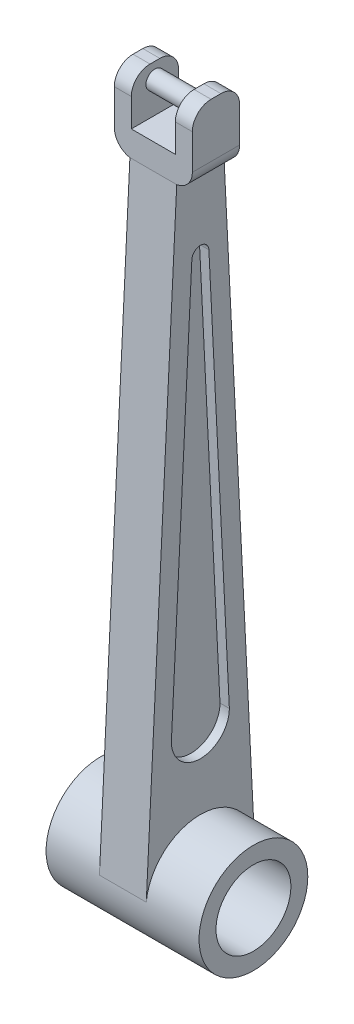
from build123d import *
from build123d.topology import SkipClean

# Parameters (mm, degrees)
Y_KSEKLIK_EKSTR_ZYON2_DEPTH      = 3.75
Y_KSEKLIK_EKSTR_ZYON3_DEPTH      = 2.25
IZIM4_R                          = 6
KES_EKSTR_ZYON1_DEPTH            = 15.5
Y_KSEKLIK_EKSTR_ZYON5_DEPTH      = 8.5
Y_KSEKLIK_EKSTR_ZYON5_DEPTH_BACK = 16
IZIM5_R                          = 8.707330246
IZIM5_R_2                        = 6
IZIM1_6_W                        = 7.569576012
IZIM1_6_H                        = 4.08664072
Y_KSEKLIK_EKSTR_ZYON6_DEPTH      = 6.25
IZIM6_W                          = 2.724991533
IZIM6_H                          = 7.569576012
Y_KSEKLIK_EKSTR_ZYON7_DEPTH      = 7.5
IZIM7_R                          = 1.441213073
Y_KSEKLIK_EKSTR_ZYON8_DEPTH      = 8.5
RADYUS1_R                        = 3


with BuildPart() as part:
    # Çizim1 → Yükseklik-Ekstrüzyon2 (new, symmetric)
    with BuildSketch(Plane(origin=(0, 0, 0), x_dir=(0, 0, -1), z_dir=(1, 0, 0))):
        with BuildLine():
            Line((3.784788006, 102.00780299), (-3.784788006, 102.00780299))
            Line((-3.784788006, 102.00780299), (-8.707330246, 4.05112335))
            ThreePointArc((-8.707330246, 4.05112335), (0, -4.656206896), (8.707330246, 4.05112335))
            Line((8.707330246, 4.05112335), (3.784788006, 102.00780299))
        make_face()
        with BuildLine():
            Line((-4.643687916, 25.141862002), (-1.364548141, 90.395470555))
            ThreePointArc((-1.364548141, 90.395470555), (0, 91.693168951), (1.364548141, 90.395470555))
            Line((1.364548141, 90.395470555), (4.643687916, 25.141862002))
            ThreePointArc((4.643687916, 25.141862002), (0, 20.498174086), (-4.643687916, 25.141862002))
        make_face(mode=Mode.SUBTRACT)
    extrude(amount=Y_KSEKLIK_EKSTR_ZYON2_DEPTH, both=True)

    # Çizim1<5> → Yükseklik-Ekstrüzyon3 (add, symmetric)
    with BuildSketch(Plane(origin=(0, 0, 0), x_dir=(0, 0, -1), z_dir=(1, 0, 0))):
        with BuildLine():
            Line((-1.364548141, 90.395470555), (-4.643687916, 25.141862002))
            ThreePointArc((-4.643687916, 25.141862002), (0, 20.498174086), (4.643687916, 25.141862002))
            Line((4.643687916, 25.141862002), (1.364548141, 90.395470555))
            ThreePointArc((1.364548141, 90.395470555), (0, 91.693168951), (-1.364548141, 90.395470555))
        make_face()
    extrude(amount=Y_KSEKLIK_EKSTR_ZYON3_DEPTH, both=True)

    # Çizim4 → Kes-Ekstrüzyon1 (cut)
    with BuildSketch(Plane(origin=(3.75, 0, 0), x_dir=(0, 0, -1), z_dir=(1, 0, 0))):
        with Locations((0, 4.05112335)):
            Circle(IZIM4_R)
    extrude(amount=-KES_EKSTR_ZYON1_DEPTH, mode=Mode.SUBTRACT)

    # Çizim5 → Yükseklik-Ekstrüzyon5 (add, two sides: drawn at the far end of the back side and taken through both)
    with SkipClean():  # the faces are left unmerged after this step: merging them gives an invalid solid
        with BuildSketch(Plane(origin=(3.75, 0, 0), x_dir=(0, 0, -1), z_dir=(1, 0, 0)).offset(-Y_KSEKLIK_EKSTR_ZYON5_DEPTH_BACK)):
            with Locations((0, 4.05112335)):
                Circle(IZIM5_R)
            with Locations((0, 4.05112335)):
                Circle(IZIM5_R_2, mode=Mode.SUBTRACT)
        extrude(amount=Y_KSEKLIK_EKSTR_ZYON5_DEPTH + Y_KSEKLIK_EKSTR_ZYON5_DEPTH_BACK)

    # Çizim1<6> → Yükseklik-Ekstrüzyon6 (add, symmetric)
    with BuildSketch(Plane(origin=(0, 0, 0), x_dir=(0, 0, -1), z_dir=(1, 0, 0))):
        with Locations((0, 104.05112335)):
            Rectangle(IZIM1_6_W, IZIM1_6_H)
    extrude(amount=Y_KSEKLIK_EKSTR_ZYON6_DEPTH, both=True)

    # Çizim6 → Yükseklik-Ekstrüzyon7 (add)
    with BuildSketch(Plane(origin=(0, 106.09444371, 0), x_dir=(1, 0, 0), z_dir=(0, 1, 0))):
        with Locations((-4.887504233, 0)):
            Rectangle(IZIM6_W, IZIM6_H)
        with Locations((4.887504233, 0)):
            Rectangle(IZIM6_W, IZIM6_H)
    extrude(amount=Y_KSEKLIK_EKSTR_ZYON7_DEPTH)

    # Çizim7 → Yükseklik-Ekstrüzyon8 (add)
    with BuildSketch(Plane(origin=(-3.525008467, 0, 0), x_dir=(0, 0, -1), z_dir=(1, 0, 0))):
        with Locations(Location((0, 111.076861872, 0), (0, 0, 180))):
            Circle(IZIM7_R)
    extrude(amount=Y_KSEKLIK_EKSTR_ZYON8_DEPTH)

    # Radyus1
    # the kernel refuses this fillet: 3 mm, written as the material it takes off along each edge
    with BuildSketch(Plane(origin=(6.25, 102.00780299, -11.179887735), x_dir=(0, 1, 0), z_dir=(0, 0, 1))) as radyus1_piece_1:
        with BuildLine():
            CenterArc((2.958039892, 3), RADYUS1_R, 189.594068227, 80.405931773)
            Line((0, 2.5), (-0.059160798, 2.49))
            ThreePointArc((-0.059160798, 2.49), (-0.06, 1.25), (-0.06, 0))
            Line((-0.06, 0), (0, -0.06))
            Line((0, -0.06), (2.958039892, -0.06))
            Line((2.958039892, -0.06), (2.958039892, 0))
        make_face()
    extrude(amount=22.359775471, mode=Mode.SUBTRACT)
    with BuildSketch(Plane(origin=(-6.25, 102.00780299, -11.179887735), x_dir=(1, 0, 0), z_dir=(0, 0, 1))) as radyus1_piece_2:
        with BuildLine():
            CenterArc((3, 2.958039892), RADYUS1_R, 180, 80.405931773)
            Line((0, 2.958039892), (-0.06, 2.958039892))
            Line((-0.06, 2.958039892), (-0.06, 0))
            Line((-0.06, 0), (0, -0.06))
            ThreePointArc((0, -0.06), (1.25, -0.06), (2.49, -0.059160798))
            Line((2.49, -0.059160798), (2.5, 0))
        make_face()
    extrude(amount=22.359775471, mode=Mode.SUBTRACT)
    with BuildSketch(Plane(origin=(13.75, 113.59444371, 3.784788006), x_dir=(0, -1, 0), z_dir=(-1, 0, 0)), Plane(origin=(-3.974991533, 113.59444371, -3.784788006), x_dir=(0, -1, 0), z_dir=(1, 0, 0)), Plane(origin=(-13.75, 113.59444371, -3.784788006), x_dir=(0, -1, 0), z_dir=(1, 0, 0)), Plane(origin=(3.974991533, 113.59444371, 3.784788006), x_dir=(0, -1, 0), z_dir=(-1, 0, 0))) as radyus1_piece_3:
        with BuildLine():
            CenterArc((RADYUS1_R, -RADYUS1_R), RADYUS1_R, 90, 90)
            Line((0, -RADYUS1_R), (-RADYUS1_R * 0.02, -RADYUS1_R))
            Line((-RADYUS1_R * 0.02, -RADYUS1_R), (-RADYUS1_R * 0.02, RADYUS1_R * 0.02))
            Line((-RADYUS1_R * 0.02, RADYUS1_R * 0.02), (RADYUS1_R, RADYUS1_R * 0.02))
            Line((RADYUS1_R, RADYUS1_R * 0.02), (RADYUS1_R, 0))
        make_face()
    extrude(amount=17.724991533, mode=Mode.SUBTRACT)


solid = part.part
